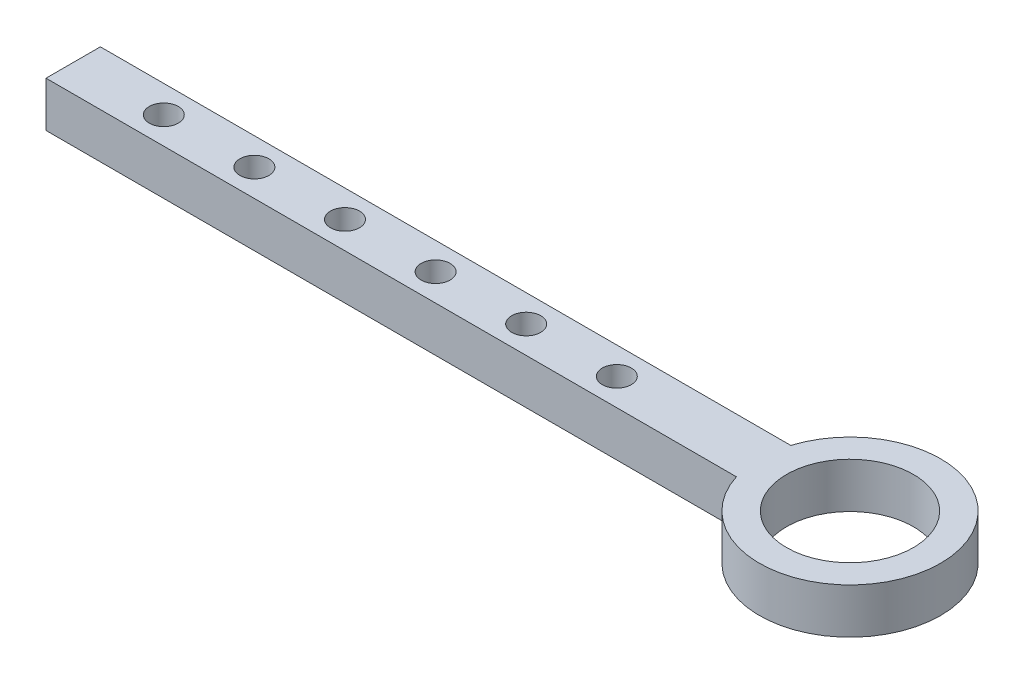
from build123d import *

# Parameters (mm, degrees)
SKETCH1_R           = 1.6
SKETCH1_R_2         = 7
BOSS_EXTRUDE1_DEPTH = 5


with BuildPart() as part:
    # Sketch1 → Boss-Extrude1 (new body)
    with BuildSketch(Plane(origin=(0, 0, 0), x_dir=(1, 0, 0), z_dir=(0, 1, 0))):
        with BuildLine():
            Line((0, 6), (0, 0))
            Line((0, 0), (76.2, 0))
            ThreePointArc((76.2, 0), (95.739392014, 3), (76.2, 6))
            Line((76.2, 6), (0, 6))
        make_face()
        with Locations((60, 3)):
            Circle(SKETCH1_R, mode=Mode.SUBTRACT)
        with Locations((50, 3)):
            Circle(SKETCH1_R, mode=Mode.SUBTRACT)
        with Locations((40, 3)):
            Circle(SKETCH1_R, mode=Mode.SUBTRACT)
        with Locations((30, 3)):
            Circle(SKETCH1_R, mode=Mode.SUBTRACT)
        with Locations((20, 3)):
            Circle(SKETCH1_R, mode=Mode.SUBTRACT)
        with Locations((10, 3)):
            Circle(SKETCH1_R, mode=Mode.SUBTRACT)
        with Locations((85.739392014, 3)):
            Circle(SKETCH1_R_2, mode=Mode.SUBTRACT)
    extrude(amount=BOSS_EXTRUDE1_DEPTH)


solid = part.part
